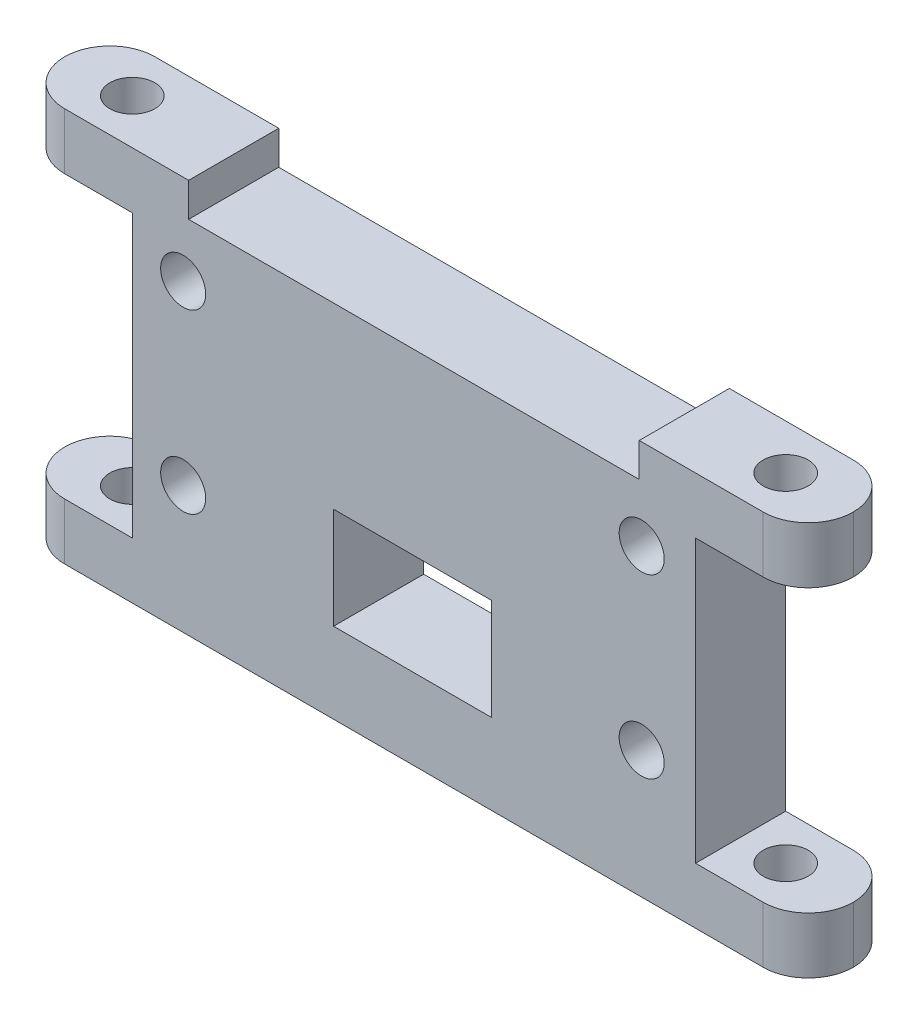
from build123d import *

# Parameters (mm, degrees)
SKETCH1_W           = 70
SKETCH1_H           = 35
BOSS_EXTRUDE1_DEPTH = 8
FILLET3_R           = 4
SKETCH7_R           = 2
CUT_EXTRUDE4_DEPTH  = 35
SKETCH8_R           = 2
SKETCH8_W           = 14
SKETCH8_H           = 9
CUT_EXTRUDE5_DEPTH  = 50.034709858
SKETCH10_W          = 40
SKETCH10_H          = 8
CUT_EXTRUDE6_DEPTH  = 3
SKETCH12_W          = 10
SKETCH12_H          = 25
CUT_EXTRUDE7_DEPTH  = 50.034709858


with BuildPart() as part:
    # Sketch1 → Boss-Extrude1 (new body)
    with BuildSketch(Plane.XY):
        with Locations((9.279257068, 1.987179487)):
            Rectangle(SKETCH1_W, SKETCH1_H)
    extrude(amount=BOSS_EXTRUDE1_DEPTH)

    # Fillet3
    fillet3_edges = [part.edges().sort_by_distance(p)[0] for p in [
        (44.279257068, 1.987179487, 0),
        (44.279257068, 1.987179487, 8),
        (-25.720742932, 1.987179487, 0),
        (-25.720742932, 1.987179487, 8),
    ]]
    fillet(fillet3_edges, radius=FILLET3_R - 0.0001)  # a hair under: the kernel refuses the full size

    # Sketch7 → Cut-Extrude4 (cut)
    with BuildSketch(Plane.XZ.offset(15.512820513)):
        with Locations((38.279257068, 4)):
            Circle(SKETCH7_R)
        with Locations((-19.720742932, 4)):
            Circle(SKETCH7_R)
    extrude(amount=-CUT_EXTRUDE4_DEPTH, mode=Mode.SUBTRACT)

    # Sketch8 → Cut-Extrude5 (cut, through all)
    with BuildSketch(Plane(origin=(0, 0, 0), x_dir=(-1, 0, 0), z_dir=(0, 0, -1))):
        with Locations((-29.494257068, -4.212820513)):
            Circle(SKETCH8_R)
        with Locations((-29.494257068, 11.487179487)):
            Circle(SKETCH8_R)
        with Locations((11.205742932, 11.487179487)):
            Circle(SKETCH8_R)
        with Locations((11.205742932, -4.212820513)):
            Circle(SKETCH8_R)
        with Locations((-9.144257068, -3.862820513)):
            Rectangle(SKETCH8_W, SKETCH8_H)
    extrude(amount=-CUT_EXTRUDE5_DEPTH, mode=Mode.SUBTRACT)

    # Sketch10 → Cut-Extrude6 (cut)
    with BuildSketch(Plane(origin=(0, 19.487179487, 0), x_dir=(1, 0, 0), z_dir=(0, 1, 0))):
        with Locations((9.279257068, -4)):
            Rectangle(SKETCH10_W, SKETCH10_H)
    extrude(amount=-CUT_EXTRUDE6_DEPTH, mode=Mode.SUBTRACT)

    # Sketch12 → Cut-Extrude7 (cut, through all)
    with BuildSketch(Plane(origin=(0, 0, 0), x_dir=(-1, 0, 0), z_dir=(0, 0, -1))):
        with Locations((20.720742932, 1.987179487)):
            Rectangle(SKETCH12_W, SKETCH12_H)
        with Locations((-39.279257068, 1.987179487)):
            Rectangle(SKETCH12_W, SKETCH12_H)
    extrude(amount=-CUT_EXTRUDE7_DEPTH, mode=Mode.SUBTRACT)


solid = part.part
